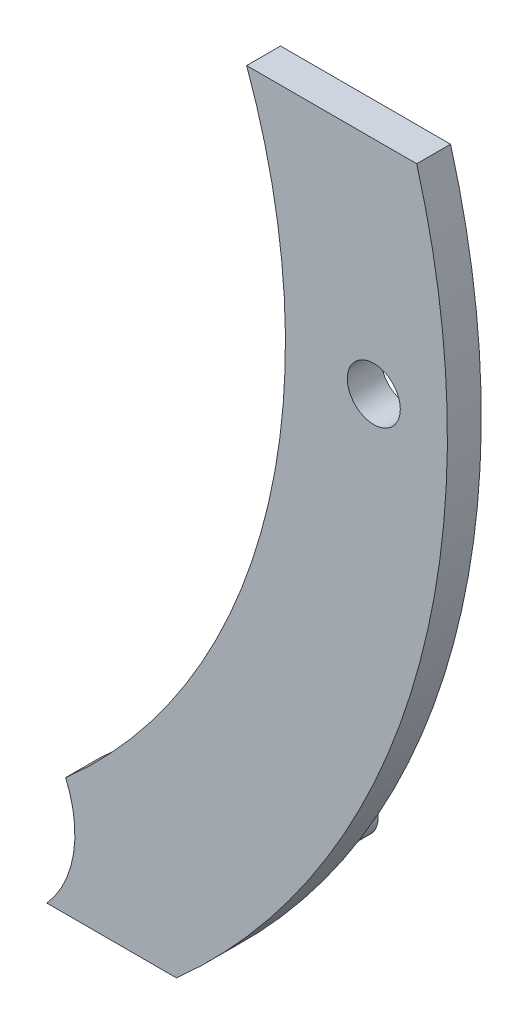
from build123d import *

# Parameters (mm, degrees)
SKETCH1_R                = 2.150000002
SKETCH1_R_2              = 35
SKETCH1_R_3              = 1.8
SKETCH1_R_4              = 7.575
BOSS_EXTRUDE1_DEPTH      = 3.175
SKETCH3_R                = 1.35
SKETCH3_R_2              = 5
SKETCH3_W                = 18
SKETCH3_H                = 3.5
CUT_EXTRUDE1_DEPTH       = 3.175
CUT_EXTRUDE2_DEPTH       = 3.175
SKETCH6_R                = 7.5
CUT_EXTRUDE5_DEPTH       = 10
FILLET1_R                = 1.75
SKETCH7_R                = 1.75
CUT_EXTRUDE6_DEPTH       = 10
SKETCH10_R               = 1.8
BOSS_EXTRUDE2_DEPTH      = 2.3
CUT_EXTRUDE7_DEPTH       = 118.49445714
CUT_EXTRUDE7_DEPTH_BACK  = 118.49445714
SKETCH11_W               = 179.014242855
SKETCH11_H               = 40.200555742
BOSS_EXTRUDE3_DEPTH      = 9.5
BOSS_EXTRUDE3_DEPTH_BACK = 2.3
CHAMFER1_SIZE            = 0.5


with BuildPart() as part:
    # Sketch1 → Boss-Extrude1 (new body)
    with BuildSketch(Plane.XY):
        with BuildLine():
            Line((69.097259206, -18.820036388), (54.057762213, -10.136978751))
            ThreePointArc((54.057762213, -10.136978751), (47.631397163, 27.499999965), (18.250000006, 51.883884719))
            Line((18.250000006, 51.883884719), (18.250000006, 69.249999994))
            ThreePointArc((18.250000006, 69.249999994), (6e-09, 87.499999994), (-18.249999994, 69.249999994))
            Line((-18.249999994, 69.249999994), (-18.249999994, 51.883884717))
            ThreePointArc((-18.249999994, 51.883884717), (-47.836716311, 27.141270525), (-53.899300523, -10.948305635))
            Line((-53.899300523, -10.948305635), (-69.097259204, -18.820036383))
            ThreePointArc((-69.097259204, -18.820036383), (-77.600405532, -29.901552426), (-75.777222821, -43.749999994))
            ThreePointArc((-75.777222821, -43.749999994), (0, -87.499999989), (75.777222821, -43.749999994))
            ThreePointArc((75.777222821, -43.749999994), (77.60040553, -29.901552429), (69.097259206, -18.820036388))
        make_face()
        with Locations((-7.778174593, 77.028174587)):
            Circle(SKETCH1_R, mode=Mode.SUBTRACT)
        Circle(SKETCH1_R_2, mode=Mode.SUBTRACT)
        with Locations((-50, 0)):
            Circle(SKETCH1_R_3, mode=Mode.SUBTRACT)
        with Locations((-25, 43.301270189)):
            Circle(SKETCH1_R_3, mode=Mode.SUBTRACT)
        with Locations((25, 43.301270189)):
            Circle(SKETCH1_R_3, mode=Mode.SUBTRACT)
        with Locations((50, 0)):
            Circle(SKETCH1_R_3, mode=Mode.SUBTRACT)
        with Locations((25, -43.301270189)):
            Circle(SKETCH1_R_3, mode=Mode.SUBTRACT)
        with Locations((-25, -43.301270189)):
            Circle(SKETCH1_R_3, mode=Mode.SUBTRACT)
        with Locations((7.778174587, 77.028174593)):
            Circle(SKETCH1_R, mode=Mode.SUBTRACT)
        with Locations((7.778174593, 61.471825413)):
            Circle(SKETCH1_R, mode=Mode.SUBTRACT)
        with Locations((-7.778174587, 61.471825407)):
            Circle(SKETCH1_R, mode=Mode.SUBTRACT)
        with Locations((62.819268711, -45.250184084)):
            Circle(SKETCH1_R, mode=Mode.SUBTRACT)
        with Locations((49.347075128, -37.472009499)):
            Circle(SKETCH1_R, mode=Mode.SUBTRACT)
        with Locations((57.125249713, -23.999815916)):
            Circle(SKETCH1_R, mode=Mode.SUBTRACT)
        with Locations((70.597443296, -31.777990501)):
            Circle(SKETCH1_R, mode=Mode.SUBTRACT)
        with Locations((-70.597443298, -31.777990509)):
            Circle(SKETCH1_R, mode=Mode.SUBTRACT)
        with Locations((-57.125249721, -23.999815914)):
            Circle(SKETCH1_R, mode=Mode.SUBTRACT)
        with Locations((-49.347075126, -37.472009491)):
            Circle(SKETCH1_R, mode=Mode.SUBTRACT)
        with Locations((-62.819268703, -45.250184086)):
            Circle(SKETCH1_R, mode=Mode.SUBTRACT)
        with Locations((0, 69.249999994)):
            Circle(SKETCH1_R_4, mode=Mode.SUBTRACT)
        with Locations((59.972259207, -34.624999997)):
            Circle(SKETCH1_R_4, mode=Mode.SUBTRACT)
        with Locations((-59.972259207, -34.624999997)):
            Circle(SKETCH1_R_4, mode=Mode.SUBTRACT)
    extrude(amount=BOSS_EXTRUDE1_DEPTH)

    # Sketch3 → Cut-Extrude1 (cut)
    with BuildSketch(Plane.XY.offset(3.175)):
        with Locations((-33.85, -49)):
            Circle(SKETCH3_R)
        with Locations((-33.85, -75)):
            Circle(SKETCH3_R)
        with Locations((41.45, -46.7)):
            Circle(SKETCH3_R)
        with Locations((49.972259207, -51.945508073)):
            Circle(SKETCH3_R_2)
        with Locations((48.55, -69)):
            Circle(SKETCH3_R)
        with Locations((30, -36.05)):
            Rectangle(SKETCH3_W, SKETCH3_H)
    extrude(amount=-CUT_EXTRUDE1_DEPTH, mode=Mode.SUBTRACT)

    # Sketch4 → Cut-Extrude2 (cut)
    with BuildSketch(Plane.XY.offset(3.175)):
        Polygon((-18.902035191, 65.231994187), (-24.642286676, 79.090187175), (-38.500479664, 73.349935689), (-32.760228178, 59.491742702), align=None)
        Polygon((-47.04154651, -48.985639752), (-56.172967945, -60.885939856), (-63.507557332, -70.444562845), (-51.607257228, -79.57598428), (-44.272667841, -70.017361292), (-35.141246406, -58.117061187), align=None)
        Polygon((65.943581701, -16.246354435), (80.815254622, -18.204247318), (82.773147505, -3.332574398), (67.901474584, -1.374681515), align=None)
    extrude(amount=-CUT_EXTRUDE2_DEPTH, mode=Mode.SUBTRACT)

    # Sketch6 → Cut-Extrude5 (cut)
    with BuildSketch(Plane.XY):
        with Locations((20, 69.25)):
            Circle(SKETCH6_R)
        with Locations((-69.972259212, -17.304491924)):
            Circle(SKETCH6_R)
    extrude(amount=CUT_EXTRUDE5_DEPTH, mode=Mode.SUBTRACT)

    # Fillet1
    fillet1_edges = [part.edges().sort_by_distance(p)[0] for p in [
        (21, -37.8, 1.5875),
        (39, -37.8, 1.5875),
        (39, -34.3, 1.5875),
        (21, -34.3, 1.5875),
    ]]
    fillet(fillet1_edges, radius=FILLET1_R - 0.0001)  # a hair under: the kernel refuses the full size

    # Sketch7 → Cut-Extrude6 (cut)
    with BuildSketch(Plane.XY.offset(3.175)):
        with Locations((-43, 10)):
            Circle(SKETCH7_R)
        with Locations((-43, -10)):
            Circle(SKETCH7_R)
    extrude(amount=-CUT_EXTRUDE6_DEPTH, mode=Mode.SUBTRACT)

    # Sketch10 → Boss-Extrude2 (add)
    with BuildSketch(Plane.XY.offset(3.175)):
        with BuildLine():
            Line((29.492976073, -37.8), (37.25, -37.8))
            ThreePointArc((37.25, -37.8), (38.487436867, -37.287436867), (39, -36.05))
            ThreePointArc((39, -36.05), (38.487436867, -34.812563133), (37.25, -34.3))
            Line((37.25, -34.3), (29.492976073, -34.3))
            ThreePointArc((29.492976073, -34.3), (29.307916131, -33.656774505), (29.066247328, -33.032609135))
            ThreePointArc((29.066247328, -33.032609135), (42.625064482, -10.913472313), (41.36423576, 15))
            Line((41.36423576, 15), (52.915026221, 15))
            ThreePointArc((52.915026221, 15), (52.809487392, -15.367434443), (36.604610365, -41.05))
            Line((36.604610365, -41.05), (27.790169944, -41.05))
            ThreePointArc((27.790169944, -41.05), (28.843379247, -39.530734431), (29.492976073, -37.8))
        make_face()
        with Locations((50, 0)):
            Circle(SKETCH10_R, mode=Mode.SUBTRACT)
    extrude(amount=BOSS_EXTRUDE2_DEPTH)

    # Sketch11 → Cut-Extrude7 (cut, two sides: drawn at the far end of the back side and taken through both)
    with BuildSketch(Plane(origin=(0, 0, 0), x_dir=(1, 0, 0), z_dir=(0, 1, 0)).offset(-CUT_EXTRUDE7_DEPTH_BACK)):
        with Locations((-6.278377224, 16.925277871)):
            Rectangle(SKETCH11_W, SKETCH11_H)
    extrude(amount=CUT_EXTRUDE7_DEPTH + CUT_EXTRUDE7_DEPTH_BACK, mode=Mode.SUBTRACT)

    # Sketch12 → Boss-Extrude3 (add, two sides: drawn at the far end of the back side and taken through both)
    with BuildSketch(Plane(origin=(0, 0, 3.175), x_dir=(-1, 0, 0), z_dir=(0, 0, -1)).offset(-BOSS_EXTRUDE3_DEPTH_BACK)):
        with BuildLine():
            Line((-29.492976073, -37.8), (-37.25, -37.8))
            ThreePointArc((-37.25, -37.8), (-38.487436867, -37.287436867), (-39, -36.05))
            ThreePointArc((-39, -36.05), (-38.487436867, -34.812563133), (-37.25, -34.3))
            Line((-37.25, -34.3), (-29.492976073, -34.3))
            ThreePointArc((-29.492976073, -34.3), (-29.7, -36.05), (-29.492976073, -37.8))
        make_face()
    extrude(amount=BOSS_EXTRUDE3_DEPTH + BOSS_EXTRUDE3_DEPTH_BACK)

    # Chamfer1
    chamfer1_edges = [part.edges().sort_by_distance(p)[0] for p in [
        (29.7, -36.05, -6.325),
        (33.371488036, -34.3, -6.325),
        (39, -36.05, -6.325),
        (33.371488036, -37.8, -6.325),
    ]]
    chamfer(chamfer1_edges, length=CHAMFER1_SIZE)


solid = part.part
